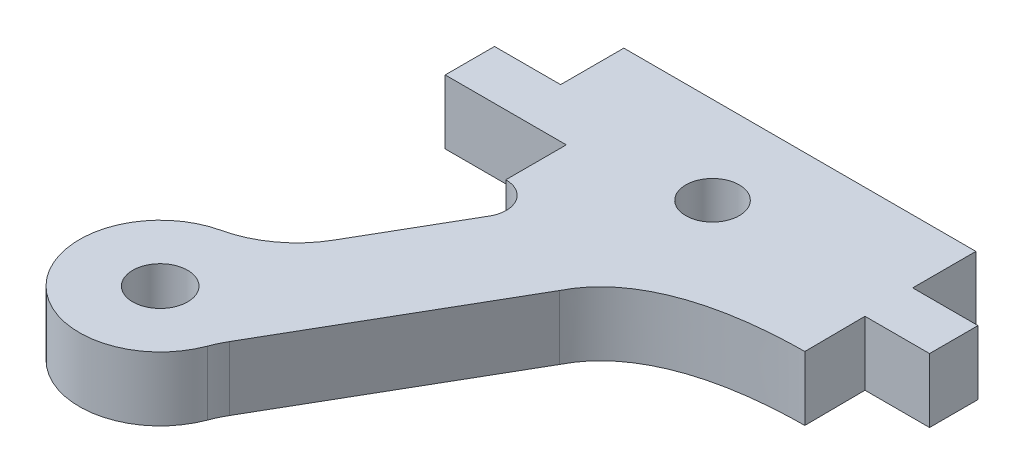
from build123d import *

# Parameters (mm, degrees)
SKETCH1_R           = 1.36
SKETCH1_R_2         = 1.3250121
BOSS_EXTRUDE1_DEPTH = 3.175


with BuildPart() as part:
    # Sketch1 → Boss-Extrude1 (new body)
    with BuildSketch(Plane(origin=(0, 0, 0), x_dir=(1, 0, 0), z_dir=(0, 1, 0))):
        with BuildLine():
            Line((112.722877294, 126.593302228), (112.72277638, 123.593222295))
            ThreePointArc((112.72277638, 123.593222295), (113.875226377, 122.941979767), (113.863024117, 121.61830725))
            Line((113.863024117, 121.61830725), (111.050643934, 116.74721322))
            ThreePointArc((111.050643934, 116.74721322), (109.689478532, 115.224141686), (107.832794667, 114.372529579))
            ThreePointArc((107.832794667, 114.372529579), (105.709889346, 107.841486649), (112.467185669, 109.066311194))
            ThreePointArc((112.467185669, 109.066311194), (112.627253492, 109.444515831), (112.817819601, 109.808308371))
            Line((112.817819601, 109.808308371), (118.803678696, 120.175836459))
            add(Edge.make_bspline(
                [(118.803678696, 120.175836459), (120.361778696, 123.269636459), (125.055778696, 123.618636459), (127.497578696, 123.636436459)],
                knots=[0.666666667, 0.666666667, 0.666666667, 0.666666667, 0.708333333, 0.708333333, 0.708333333, 0.708333333], degree=3))
            Line((127.497578696, 123.636436459), (127.475978696, 126.636436459))
            Line((127.475978696, 126.636436459), (130.675779856, 126.636436459))
            Line((130.675779856, 126.636436459), (130.675779856, 129.036436459))
            Line((130.675779856, 129.036436459), (127.440025111, 129.036436459))
            Line((127.440025111, 129.036436459), (127.440025111, 132.168236459))
            Line((127.440025111, 132.168236459), (109.997615958, 132.168236459))
            Line((109.997615958, 132.168236459), (109.997615958, 129.036436459))
            Line((109.997615958, 129.036436459), (106.722915958, 129.036436459))
            Line((106.722915958, 129.036436459), (106.722915958, 126.593302228))
            Line((106.722915958, 126.593302228), (112.722877294, 126.593302228))
        make_face()
        with Locations((108.72260063, 110.472754541)):
            Circle(SKETCH1_R, mode=Mode.SUBTRACT)
        with Locations((118.723210584, 127.836436459)):
            Circle(SKETCH1_R_2, mode=Mode.SUBTRACT)
    extrude(amount=BOSS_EXTRUDE1_DEPTH)


solid = part.part
